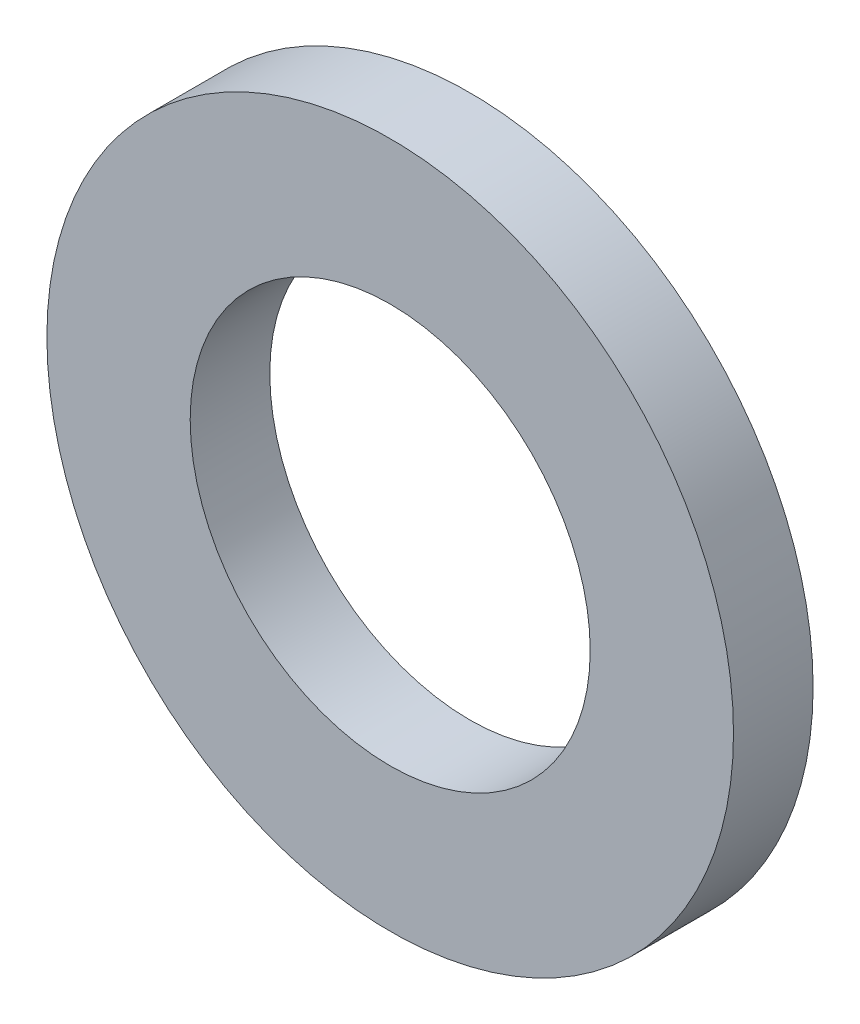
from build123d import *

# Parameters (mm, degrees)
SKETCH1_R           = 17.25
SKETCH1_R_2         = 10.05
BOSS_EXTRUDE1_DEPTH = 4


with BuildPart() as part:
    # Sketch1 → Boss-Extrude1 (new body)
    with BuildSketch(Plane.XY):
        Circle(SKETCH1_R)
        Circle(SKETCH1_R_2, mode=Mode.SUBTRACT)
    extrude(amount=BOSS_EXTRUDE1_DEPTH)


solid = part.part
